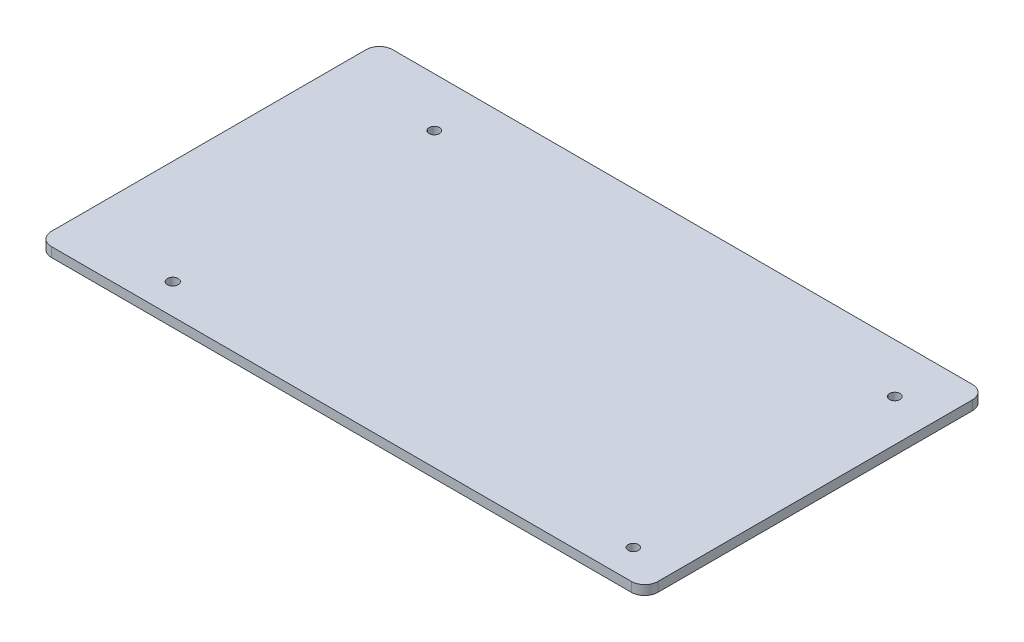
from build123d import *

# Parameters (mm, degrees)
BOSS_EXTRUDE1_OUTLINE_R   = 1.426531271
BOSS_EXTRUDE1_OUTLINE_R_2 = 1.343679746
BOSS_EXTRUDE1_OUTLINE_R_3 = 1.378285228
BOSS_EXTRUDE1_OUTLINE_R_4 = 1.385856135
BOSS_EXTRUDE1_DEPTH       = 2.5
BOSS_EXTRUDE2_START       = -3
SKETCH1_3_R               = 3
SKETCH1_3_R_2             = 1.378285228
SKETCH1_3_R_3             = 1.385856135
SKETCH1_3_R_4             = 1.343679746
SKETCH1_3_R_5             = 1.426531271
BOSS_EXTRUDE2_DEPTH       = 3
FILLET1_R                 = 3


# Read off the part's stored shape, not the designer's step: Boss-Extrude1
with BuildPart() as part:
    # Boss-Extrude1 outline → Boss-Extrude1 (new body)
    with BuildSketch(Plane(origin=(0, 0, 0), x_dir=(1, 0, 0), z_dir=(0, 1, 0))):
        with BuildLine():
            Line((-76.498848721, -45), (76.503120692, -45.002303107))
            ThreePointArc((76.503120692, -45.002303107), (78.976602231, -43.977753507), (80.001151831, -41.504271968))
            Line((80.001151831, -41.504271968), (80.001151831, 41.501969416))
            ThreePointArc((80.001151831, 41.501969416), (78.977276633, 43.973822805), (76.505423244, 44.997698002))
            Line((76.505423244, 44.997698002), (-76.373794917, 44.999998119))
            ThreePointArc((-76.373794917, 44.999998119), (-78.930513463, 44.02078083), (-79.998848724, 41.5))
            Line((-79.998848724, 41.5), (-80.001153885, -41.501969416))
            ThreePointArc((-80.001153885, -41.501969416), (-78.975092852, -43.976962316), (-76.498848721, -45))
        make_face()
        with Locations((-52.498848724, -37)):
            Circle(BOSS_EXTRUDE1_OUTLINE_R, mode=Mode.SUBTRACT)
        with Locations((69.001151276, -37)):
            Circle(BOSS_EXTRUDE1_OUTLINE_R_2, mode=Mode.SUBTRACT)
        with Locations((-52.498848724, 32)):
            Circle(BOSS_EXTRUDE1_OUTLINE_R_3, mode=Mode.SUBTRACT)
        with Locations((69.001151276, 32)):
            Circle(BOSS_EXTRUDE1_OUTLINE_R_4, mode=Mode.SUBTRACT)
    extrude(amount=BOSS_EXTRUDE1_DEPTH)

    # Sketch1<3> → Boss-Extrude2 (add)
    # profile 1 of 4: a face of its own
    with BuildSketch(Plane(origin=(0, 0, 0), x_dir=(1, 0, 0), z_dir=(0, 1, 0)).offset(BOSS_EXTRUDE2_START)):
        with Locations(Location((-52.498848724, 32, 0), (0, 0, 270))):
            Circle(SKETCH1_3_R)
        with Locations(Location((-52.498848724, 32, 0), (0, 0, 270))):
            Circle(SKETCH1_3_R_2, mode=Mode.SUBTRACT)
    # profile 2 of 4: a face of its own
    with BuildSketch(Plane(origin=(0, 0, 0), x_dir=(1, 0, 0), z_dir=(0, 1, 0)).offset(BOSS_EXTRUDE2_START)):
        with Locations(Location((69.001151276, 32, 0), (0, 0, 270))):
            Circle(SKETCH1_3_R)
        with Locations(Location((69.001151276, 32, 0), (0, 0, 270))):
            Circle(SKETCH1_3_R_3, mode=Mode.SUBTRACT)
    # profile 3 of 4: a face of its own
    with BuildSketch(Plane(origin=(0, 0, 0), x_dir=(1, 0, 0), z_dir=(0, 1, 0)).offset(BOSS_EXTRUDE2_START)):
        with Locations(Location((69.001151276, -37, 0), (0, 0, 270))):
            Circle(SKETCH1_3_R)
        with Locations(Location((69.001151276, -37, 0), (0, 0, 270))):
            Circle(SKETCH1_3_R_4, mode=Mode.SUBTRACT)
    # profile 4 of 4: a face of its own
    with BuildSketch(Plane(origin=(0, 0, 0), x_dir=(1, 0, 0), z_dir=(0, 1, 0)).offset(BOSS_EXTRUDE2_START)):
        with Locations(Location((-52.498848724, -37, 0), (0, 0, 270))):
            Circle(SKETCH1_3_R)
        with Locations(Location((-52.498848724, -37, 0), (0, 0, 270))):
            Circle(SKETCH1_3_R_5, mode=Mode.SUBTRACT)
    extrude(amount=BOSS_EXTRUDE2_DEPTH)

    # Fillet1
    fillet1_edges = [part.edges().sort_by_distance(p)[0] for p in [
        (-52.498848724, 0, -35),
        (69.001151276, 0, -35),
        (69.001151276, 0, 34),
        (-52.498848724, 0, 34),
    ]]
    fillet(fillet1_edges, radius=FILLET1_R - 0.0001)  # a hair under: the kernel refuses the full size


solid = part.part
